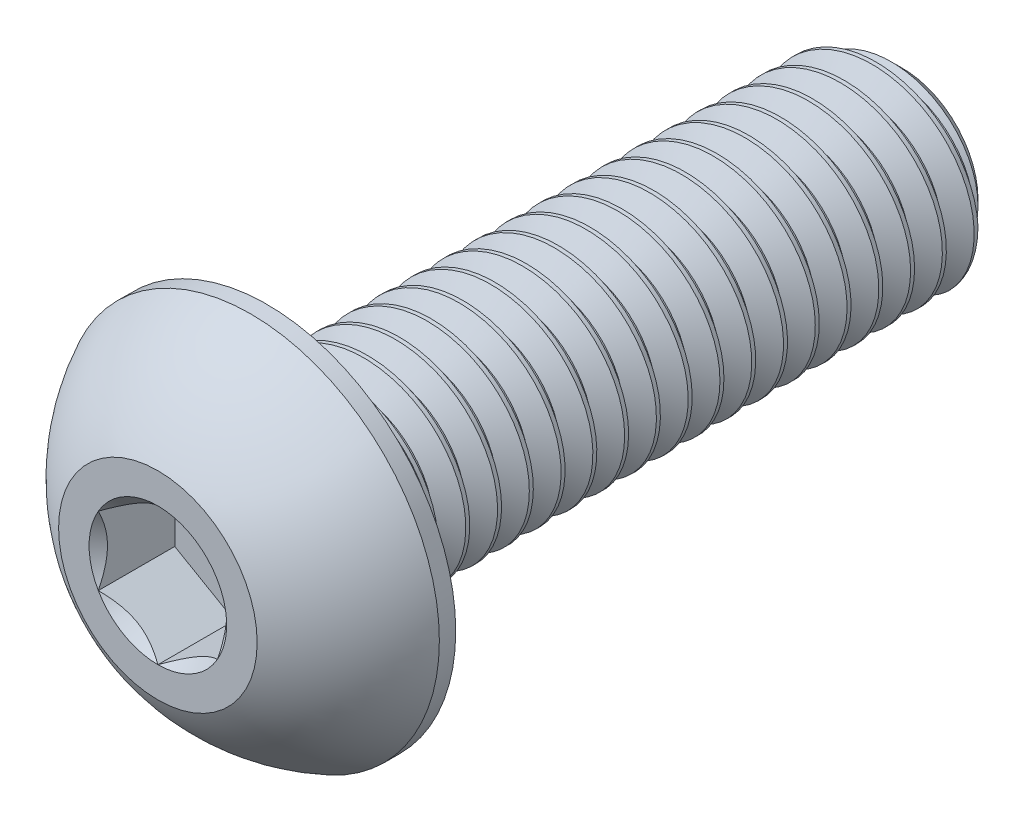
from build123d import *

# Parameters (mm, degrees)
CUT_EXTRUDE2_DEPTH = 1.925
CUT_SWEEP2_PITCH   = 0.8
CUT_SWEEP2_TO      = 16


with BuildPart() as part:
    # Sketch10 → Revolve3 (revolve)
    with BuildSketch(Plane(origin=(0, 0, 0), x_dir=(0, 0, -1), z_dir=(1, 0, 0)), mode=Mode.PRIVATE) as revolve3_sk:
        Polygon((18.15, 2.5), (18.75, 1.9), (18.75, 0), (2.75, 0), (2.75, 2.5), align=None)
    revolve(revolve3_sk.sketch.rotate(Axis((0, 0, 0), (0, 0, -1)), 90), axis=Axis((0, 0, 0), (0, 0, -1)))

    # Sketch7 → Revolve2 (revolve)
    with BuildSketch(Plane(origin=(0, 0, 0), x_dir=(0, 0, -1), z_dir=(1, 0, 0)), mode=Mode.PRIVATE) as revolve2_sk:
        with BuildLine():
            Line((2.3375, 4.75), (2.75, 4.75))
            Line((2.75, 4.75), (2.75, 0))
            Line((2.75, 0), (0, 0))
            Line((0, 0), (0, 2.5))
            ThreePointArc((0, 2.5), (0.991875183, 3.808753282), (2.3375, 4.75))
        make_face()
    revolve(revolve2_sk.sketch.rotate(Axis((0, 0, 0), (0, 0, -1)), 180), axis=Axis((0, 0, 0), (0, 0, -1)))

    # Sketch5 → Cut-Extrude2 (cut)
    with BuildSketch(Plane.XY):
        Polygon((1.5, -0.866025404), (1.5, 0.866025404), (0, 1.732050808), (-1.5, 0.866025404), (-1.5, -0.866025404), (0, -1.732050808), align=None)
    extrude(amount=-CUT_EXTRUDE2_DEPTH, mode=Mode.SUBTRACT)

    # Cut-Extrude3 cone 1 section (through the dimple's axis) → Cut-Extrude3 (revolve, cut)
    with BuildSketch(Plane(origin=(0, 0, 0), x_dir=(0, -1, 0), z_dir=(1, 0, 0))):
        Polygon((0, 0), (1.732050808, 0), (0, 1.732050808), align=None)
    revolve(axis=Axis((0, 0, 0), (0, 0, -1)), mode=Mode.SUBTRACT)


with BuildPart() as body_2:
    # Split1: read off the stored shape, not the designer's step
    # Split1: the piece on the far side of the plane
    add(part.part)
    split(bisect_by=Plane.XY.offset(-2.75), keep=Keep.BOTTOM)

    # Cut-Sweep2: arcs per turn and ends read off the stored shape
    # Cut-Sweep2: the profile of Sketch12 screwed along a right-hand helix through 25 turns, 8 arcs to a turn; built about Z, then put on its axis
    cut_sweep2_z = Axis((0, 0, 0), (0, 0, 1))
    cut_sweep2_corners = [(1.980384758, 0, -0.3), (1.980384758, 0, -0.4), (2.54330127, 0, -0.725), (2.54330127, 0, 0.025)]
    with BuildLine(mode=Mode.PRIVATE) as cut_sweep2_profile:
        Line(cut_sweep2_corners[0], cut_sweep2_corners[1])
        Line(cut_sweep2_corners[1], cut_sweep2_corners[2])
        Line(cut_sweep2_corners[2], cut_sweep2_corners[3])
        Line(cut_sweep2_corners[3], cut_sweep2_corners[0])
    cut_sweep2_cap = Face(cut_sweep2_profile.wire())
    cut_sweep2_turn_angles = [0, 22.5, 45, 67.5, 90, 112.5, 135, 157.5, 180, 202.5, 225, 247.5, 270, 292.5, 315, 337.5, 360]
    cut_sweep2_turn_weights = [1, 0.9238795325112867, 1, 0.9238795325112867, 1, 0.9238795325112867, 1, 0.9238795325112867, 1, 0.9238795325112867, 1, 0.9238795325112867, 1, 0.9238795325112867, 1, 0.9238795325112867, 1]
    cut_sweep2_turn_rails = [Edge.make_bspline([Vector(p[0], p[1], 0).rotate(cut_sweep2_z, cut_sweep2_turn_angles[k]) / cut_sweep2_turn_weights[k] + Vector(0, 0, p[2] + CUT_SWEEP2_PITCH * cut_sweep2_turn_angles[k] / 360) for k in range(17)], [0, 0, 0, 1, 1, 2, 2, 3, 3, 4, 4, 5, 5, 6, 6, 7, 7, 8, 8, 8], 2, cut_sweep2_turn_weights) for p in cut_sweep2_corners]
    cut_sweep2_turn_sides = [Face.make_surface_from_curves(cut_sweep2_turn_rails[p[0]], cut_sweep2_turn_rails[p[1]]) for p in [(0, 1), (1, 2), (2, 3), (3, 0)]]
    cut_sweep2 = Plane(origin=(0, 0, -18.75), x_dir=(0, 1, 0), z_dir=(0, 0, 1)) * split(Solid(Shell([*[p.moved(Location((0, 0, CUT_SWEEP2_PITCH * i))) for i in range(25) for p in cut_sweep2_turn_sides], cut_sweep2_cap, cut_sweep2_cap.rotate(cut_sweep2_z, 9000).moved(Location((0, 0, CUT_SWEEP2_PITCH * 9000 / 360)))])), bisect_by=Plane.XY.offset(CUT_SWEEP2_TO), keep=Keep.BOTTOM, mode=Mode.PRIVATE)
    add(cut_sweep2, mode=Mode.SUBTRACT)


with BuildPart() as part_1:
    add(part.part)

    # Split1
    split(bisect_by=Plane.XY.offset(-2.75), keep=Keep.TOP)

    add(body_2.part)  # Boss-Extrude1 merges body 2
    # Boss-Extrude1 cone 1 section (through the dimple's axis) → Boss-Extrude1 (revolve)
    with BuildSketch(Plane(origin=(0, 0, -2.75), x_dir=(0, -1, 0), z_dir=(1, 0, 0))):
        Polygon((0, 0), (2.5, 0), (0, 2.5), align=None)
    revolve(axis=Axis((0, 0, -2.75), (0, 0, -1)))


solid = part_1.part
